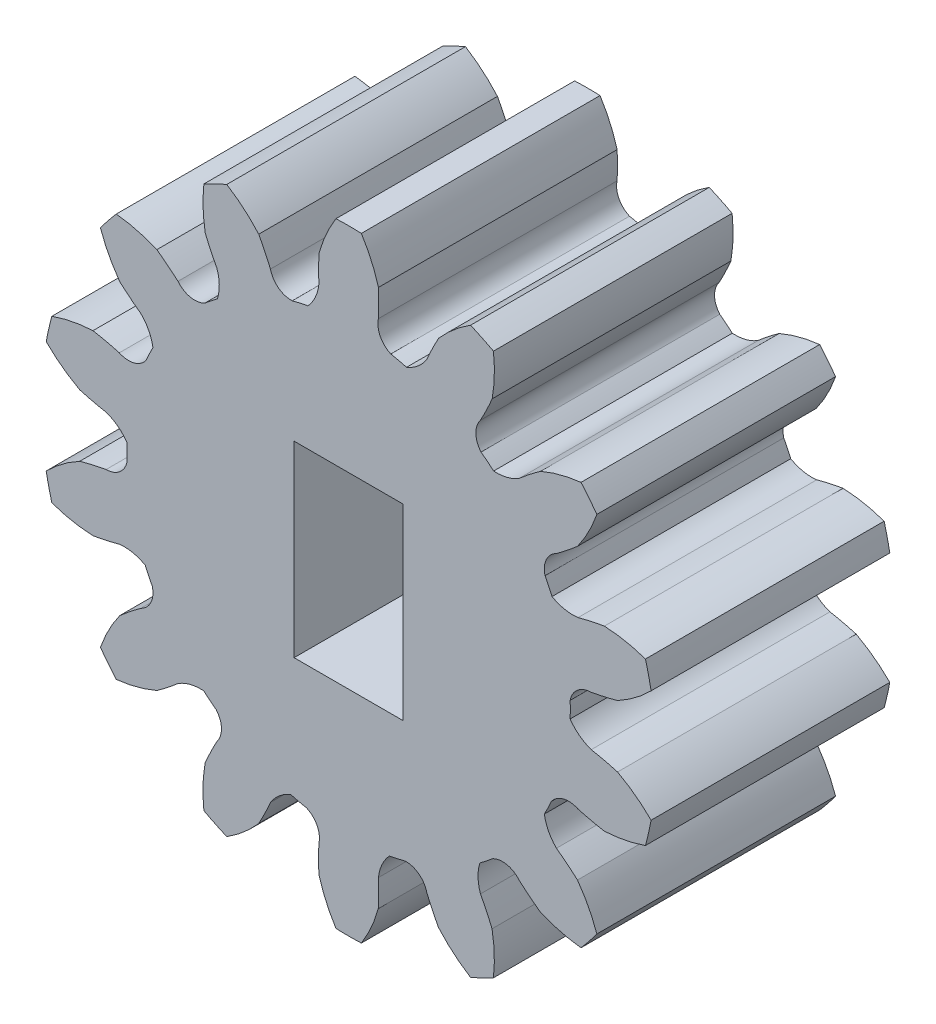
from build123d import *

# Parameters (mm, degrees)
BOSS_EXTRUDE1_DEPTH    = 7
BOSS_EXTRUDE1_2_DEPTH  = 7
BOSS_EXTRUDE1_3_DEPTH  = 7
BOSS_EXTRUDE1_4_DEPTH  = 7
BOSS_EXTRUDE1_5_DEPTH  = 7
BOSS_EXTRUDE1_6_DEPTH  = 7
BOSS_EXTRUDE1_7_DEPTH  = 7
BOSS_EXTRUDE1_8_DEPTH  = 7
BOSS_EXTRUDE1_9_DEPTH  = 7
BOSS_EXTRUDE1_10_DEPTH = 7
BOSS_EXTRUDE1_11_DEPTH = 7
BOSS_EXTRUDE1_12_DEPTH = 7
BOSS_EXTRUDE1_13_DEPTH = 7
BOSS_EXTRUDE1_14_DEPTH = 7
SKETCH1_R              = 6.5
BOSS_EXTRUDE2_DEPTH    = 7
SKETCH3_W              = 3.2
SKETCH3_H              = 5.5
CUT_EXTRUDE1_DEPTH     = 6


with BuildPart() as part:
    # Sketch2 → Boss-Extrude1 (new body)
    with BuildSketch(Plane.XY.offset(20)):
        with BuildLine():
            ThreePointArc((-0.372442837, 29.93778576), (0, 29.945381287), (0.372442837, 29.93778576))
            ThreePointArc((0.372442837, 29.93778576), (0.664207711, 29.394961978), (0.87300932, 28.815146242))
            ThreePointArc((0.87300932, 28.815146242), (0.882118298, 28.419135302), (0.87300932, 28.023124361))
            ThreePointArc((0.87300932, 28.023124361), (0.925832605, 27.599473266), (1.236429032, 27.306556197))
            ThreePointArc((1.236429032, 27.306556197), (0.022155909, 27.42519857), (-1.192897802, 27.314836852))
            ThreePointArc((-1.192897802, 27.314836852), (-0.97608072, 27.643294757), (-0.87300932, 28.023124361))
            ThreePointArc((-0.87300932, 28.023124361), (-0.8804421, 28.419198634), (-0.867969423, 28.815146242))
            ThreePointArc((-0.867969423, 28.815146242), (-0.661618034, 29.394744976), (-0.372442837, 29.93778576))
        make_face()
    extrude(amount=BOSS_EXTRUDE1_DEPTH)



with BuildPart() as body_2:
    # Sketch2 → Boss-Extrude1 2 (new body)
    with BuildSketch(Plane.XY.offset(20)):
        with BuildLine():
            ThreePointArc((1.697579984, 27.199646438), (2.840189705, 26.771886862), (3.882734989, 26.138140415))
            ThreePointArc((3.882734989, 26.138140415), (3.729989232, 26.536812314), (3.866212417, 26.941427926))
            ThreePointArc((3.866212417, 26.941427926), (4.04624203, 27.294269217), (4.209857833, 27.655014984))
            ThreePointArc((4.209857833, 27.655014984), (4.273306703, 28.268006533), (4.245958047, 28.883665896))
            ThreePointArc((4.245958047, 28.883665896), (3.913694222, 29.052106121), (3.574839244, 29.206859677))
            ThreePointArc((3.574839244, 29.206859677), (3.078684828, 28.843065253), (2.641290186, 28.41039735))
            ThreePointArc((2.641290186, 28.41039735), (2.458257463, 28.059072574), (2.29310398, 27.698997022))
            ThreePointArc((2.29310398, 27.698997022), (2.035437968, 27.401503378), (1.697579984, 27.199646438))
        make_face()
    extrude(amount=BOSS_EXTRUDE1_2_DEPTH)


with BuildPart() as body_3:
    # Sketch2 → Boss-Extrude1 3 (new body)
    with BuildSketch(Plane.XY.offset(20)):
        with BuildLine():
            ThreePointArc((4.251831235, 25.84173215), (5.095689097, 24.960574312), (5.760017664, 23.937245047))
            ThreePointArc((5.760017664, 23.937245047), (5.795375746, 24.362709917), (6.093664729, 24.668150961))
            ThreePointArc((6.093664729, 24.668150961), (6.408957905, 24.907938059), (6.712892371, 25.161968527))
            ThreePointArc((6.712892371, 25.161968527), (7.036024894, 25.686725397), (7.278509192, 26.253281452))
            ThreePointArc((7.278509192, 26.253281452), (7.052233304, 26.549204722), (6.81408057, 26.835656524))
            ThreePointArc((6.81408057, 26.835656524), (6.209216403, 26.723162406), (5.62740988, 26.523120518))
            ThreePointArc((5.62740988, 26.523120518), (5.310068987, 26.286002754), (5.005039914, 26.033243303))
            ThreePointArc((5.005039914, 26.033243303), (4.643813204, 25.877007884), (4.251831235, 25.84173215))
        make_face()
    extrude(amount=BOSS_EXTRUDE1_3_DEPTH)


with BuildPart() as body_4:
    # Sketch2 → Boss-Extrude1 4 (new body)
    with BuildSketch(Plane.XY.offset(20)):
        with BuildLine():
            ThreePointArc((5.963955164, 23.510045569), (6.341924769, 22.350013584), (6.496458198, 21.139784413))
            ThreePointArc((6.496458198, 21.139784413), (6.712917018, 21.507773718), (7.114192008, 21.65354385))
            ThreePointArc((7.114192008, 21.65354385), (7.502301066, 21.732783978), (7.886356247, 21.829785299))
            ThreePointArc((7.886356247, 21.829785299), (8.405172063, 22.162372954), (8.869462327, 22.567612329))
            ThreePointArc((8.869462327, 22.567612329), (8.793991091, 22.93240741), (8.703709671, 23.293822164))
            ThreePointArc((8.703709671, 23.293822164), (8.109936518, 23.454909193), (7.498952032, 23.52711407))
            ThreePointArc((7.498952032, 23.52711407), (7.110156225, 23.451167399), (6.725666309, 23.355786157))
            ThreePointArc((6.725666309, 23.355786157), (6.332424282, 23.371753304), (5.963955164, 23.510045569))
        make_face()
    extrude(amount=BOSS_EXTRUDE1_4_DEPTH)


with BuildPart() as body_5:
    # Sketch2 → Boss-Extrude1 5 (new body)
    with BuildSketch(Plane.XY.offset(20)):
        with BuildLine():
            ThreePointArc((6.49484463, 20.666405817), (6.332064462, 19.457258248), (5.946195512, 18.299829899))
            ThreePointArc((5.946195512, 18.299829899), (6.300882746, 18.537458845), (6.725666309, 18.494686503))
            ThreePointArc((6.725666309, 18.494686503), (7.109721491, 18.397685182), (7.497830549, 18.318445054))
            ThreePointArc((7.497830549, 18.318445054), (8.109571823, 18.392990431), (8.703709671, 18.556650496))
            ThreePointArc((8.703709671, 18.556650496), (8.793991091, 18.91806525), (8.869462327, 19.282860332))
            ThreePointArc((8.869462327, 19.282860332), (8.404384244, 19.685623245), (7.885234765, 20.015773825))
            ThreePointArc((7.885234765, 20.015773825), (7.501989821, 20.116040417), (7.114192008, 20.19692881))
            ThreePointArc((7.114192008, 20.19692881), (6.766821069, 20.381936033), (6.49484463, 20.666405817))
        make_face()
    extrude(amount=BOSS_EXTRUDE1_5_DEPTH)


with BuildPart() as body_6:
    # Sketch2 → Boss-Extrude1 6 (new body)
    with BuildSketch(Plane.XY.offset(20)):
        with BuildLine():
            ThreePointArc((5.739350463, 17.874030623), (5.06806113, 16.855253974), (4.21821588, 15.979869328))
            ThreePointArc((4.21821588, 15.979869328), (4.640881371, 16.040072587), (5.005039914, 15.817229357))
            ThreePointArc((5.005039914, 15.817229357), (5.30897438, 15.563198889), (5.624267555, 15.323411791))
            ThreePointArc((5.624267555, 15.323411791), (6.207771425, 15.125150264), (6.81408057, 15.014816136))
            ThreePointArc((6.81408057, 15.014816136), (7.052233304, 15.301267938), (7.278509192, 15.597191208))
            ThreePointArc((7.278509192, 15.597191208), (7.034240598, 16.161857871), (6.709750047, 16.684563783))
            ThreePointArc((6.709750047, 16.684563783), (6.407962328, 16.94118461), (6.093664729, 17.182321699))
            ThreePointArc((6.093664729, 17.182321699), (5.860965954, 17.499726049), (5.739350463, 17.874030623))
        make_face()
    extrude(amount=BOSS_EXTRUDE1_6_DEPTH)


with BuildPart() as body_7:
    # Sketch2 → Boss-Extrude1 7 (new body)
    with BuildSketch(Plane.XY.offset(20)):
        with BuildLine():
            ThreePointArc((3.847107548, 15.68598414), (2.800266136, 15.059359621), (1.65476686, 14.639399342))
            ThreePointArc((1.65476686, 14.639399342), (2.061696523, 14.510252921), (2.29310398, 14.151475639))
            ThreePointArc((2.29310398, 14.151475639), (2.456719782, 13.790729872), (2.636749396, 13.43788858))
            ThreePointArc((2.636749396, 13.43788858), (3.076445764, 13.006088276), (3.574839244, 12.643612983))
            ThreePointArc((3.574839244, 12.643612983), (3.913694222, 12.798366539), (4.245958047, 12.966806765))
            ThreePointArc((4.245958047, 12.966806765), (4.270879331, 13.58153802), (4.205317042, 14.193270947))
            ThreePointArc((4.205317042, 14.193270947), (4.044759307, 14.555419107), (3.866212417, 14.909044735))
            ThreePointArc((3.866212417, 14.909044735), (3.794274651, 15.295980387), (3.847107548, 15.68598414))
        make_face()
    extrude(amount=BOSS_EXTRUDE1_7_DEPTH)


with BuildPart() as body_8:
    # Sketch2 → Boss-Extrude1 8 (new body)
    with BuildSketch(Plane.XY.offset(20)):
        with BuildLine():
            ThreePointArc((1.192897802, 14.535635808), (-0.022155909, 14.425274091), (-1.236429032, 14.543916463))
            ThreePointArc((-1.236429032, 14.543916463), (-0.925832605, 14.250999394), (-0.87300932, 13.827348299))
            ThreePointArc((-0.87300932, 13.827348299), (-0.882118298, 13.431337359), (-0.87300932, 13.035326418))
            ThreePointArc((-0.87300932, 13.035326418), (-0.664207711, 12.455510682), (-0.372442837, 11.912686901))
            ThreePointArc((-0.372442837, 11.912686901), (0, 11.905091373), (0.372442837, 11.912686901))
            ThreePointArc((0.372442837, 11.912686901), (0.661618034, 12.455727684), (0.867969423, 13.035326418))
            ThreePointArc((0.867969423, 13.035326418), (0.8804421, 13.431274026), (0.87300932, 13.827348299))
            ThreePointArc((0.87300932, 13.827348299), (0.97608072, 14.207177903), (1.192897802, 14.535635808))
        make_face()
    extrude(amount=BOSS_EXTRUDE1_8_DEPTH)


with BuildPart() as body_9:
    # Sketch2 → Boss-Extrude1 9 (new body)
    with BuildSketch(Plane.XY.offset(20)):
        with BuildLine():
            ThreePointArc((-1.697579984, 14.650826223), (-2.840189705, 15.078585798), (-3.882734989, 15.712332245))
            ThreePointArc((-3.882734989, 15.712332245), (-3.729989232, 15.313660346), (-3.866212417, 14.909044735))
            ThreePointArc((-3.866212417, 14.909044735), (-4.04624203, 14.556203443), (-4.209857833, 14.195457676))
            ThreePointArc((-4.209857833, 14.195457676), (-4.273306703, 13.582466127), (-4.245958047, 12.966806765))
            ThreePointArc((-4.245958047, 12.966806765), (-3.913694222, 12.798366539), (-3.574839244, 12.643612983))
            ThreePointArc((-3.574839244, 12.643612983), (-3.078684828, 13.007407407), (-2.641290186, 13.44007531))
            ThreePointArc((-2.641290186, 13.44007531), (-2.458257463, 13.791400086), (-2.29310398, 14.151475639))
            ThreePointArc((-2.29310398, 14.151475639), (-2.035437968, 14.448969282), (-1.697579984, 14.650826223))
        make_face()
    extrude(amount=BOSS_EXTRUDE1_9_DEPTH)


with BuildPart() as body_10:
    # Sketch2 → Boss-Extrude1 10 (new body)
    with BuildSketch(Plane.XY.offset(20)):
        with BuildLine():
            ThreePointArc((-4.251831235, 16.00874051), (-5.095689097, 16.889898348), (-5.760017664, 17.913227613))
            ThreePointArc((-5.760017664, 17.913227613), (-5.795375746, 17.487762743), (-6.093664729, 17.182321699))
            ThreePointArc((-6.093664729, 17.182321699), (-6.408957905, 16.942534602), (-6.712892371, 16.688504133))
            ThreePointArc((-6.712892371, 16.688504133), (-7.036024894, 16.163747263), (-7.278509192, 15.597191208))
            ThreePointArc((-7.278509192, 15.597191208), (-7.052233304, 15.301267938), (-6.81408057, 15.014816136))
            ThreePointArc((-6.81408057, 15.014816136), (-6.209216403, 15.127310254), (-5.62740988, 15.327352142))
            ThreePointArc((-5.62740988, 15.327352142), (-5.310068987, 15.564469906), (-5.005039914, 15.817229357))
            ThreePointArc((-5.005039914, 15.817229357), (-4.643813204, 15.973464776), (-4.251831235, 16.00874051))
        make_face()
    extrude(amount=BOSS_EXTRUDE1_10_DEPTH)


with BuildPart() as body_11:
    # Sketch2 → Boss-Extrude1 11 (new body)
    with BuildSketch(Plane.XY.offset(20)):
        with BuildLine():
            ThreePointArc((-5.963955164, 18.340427091), (-6.341924769, 19.500459076), (-6.496458198, 20.710688248))
            ThreePointArc((-6.496458198, 20.710688248), (-6.712917018, 20.342698943), (-7.114192008, 20.19692881))
            ThreePointArc((-7.114192008, 20.19692881), (-7.502301066, 20.117688682), (-7.886356247, 20.020687361))
            ThreePointArc((-7.886356247, 20.020687361), (-8.405172063, 19.688099706), (-8.869462327, 19.282860332))
            ThreePointArc((-8.869462327, 19.282860332), (-8.793991091, 18.91806525), (-8.703709671, 18.556650496))
            ThreePointArc((-8.703709671, 18.556650496), (-8.109936518, 18.395563467), (-7.498952032, 18.323358591))
            ThreePointArc((-7.498952032, 18.323358591), (-7.110156225, 18.399305261), (-6.725666309, 18.494686503))
            ThreePointArc((-6.725666309, 18.494686503), (-6.332424282, 18.478719356), (-5.963955164, 18.340427091))
        make_face()
    extrude(amount=BOSS_EXTRUDE1_11_DEPTH)


with BuildPart() as body_12:
    # Sketch2 → Boss-Extrude1 12 (new body)
    with BuildSketch(Plane.XY.offset(20)):
        with BuildLine():
            ThreePointArc((-6.49484463, 21.184066843), (-6.332064462, 22.393214413), (-5.946195512, 23.550642761))
            ThreePointArc((-5.946195512, 23.550642761), (-6.300882746, 23.313013816), (-6.725666309, 23.355786157))
            ThreePointArc((-6.725666309, 23.355786157), (-7.109721491, 23.452787479), (-7.497830549, 23.532027606))
            ThreePointArc((-7.497830549, 23.532027606), (-8.109571823, 23.457482229), (-8.703709671, 23.293822164))
            ThreePointArc((-8.703709671, 23.293822164), (-8.793991091, 22.93240741), (-8.869462327, 22.567612329))
            ThreePointArc((-8.869462327, 22.567612329), (-8.404384244, 22.164849415), (-7.885234765, 21.834698836))
            ThreePointArc((-7.885234765, 21.834698836), (-7.501989821, 21.734432243), (-7.114192008, 21.65354385))
            ThreePointArc((-7.114192008, 21.65354385), (-6.766821069, 21.468536627), (-6.49484463, 21.184066843))
        make_face()
    extrude(amount=BOSS_EXTRUDE1_12_DEPTH)


with BuildPart() as body_13:
    # Sketch2 → Boss-Extrude1 13 (new body)
    with BuildSketch(Plane.XY.offset(20)):
        with BuildLine():
            ThreePointArc((-5.739350463, 23.976442037), (-5.06806113, 24.995218686), (-4.21821588, 25.870603333))
            ThreePointArc((-4.21821588, 25.870603333), (-4.640881371, 25.810400073), (-5.005039914, 26.033243303))
            ThreePointArc((-5.005039914, 26.033243303), (-5.30897438, 26.287273771), (-5.624267555, 26.527060869))
            ThreePointArc((-5.624267555, 26.527060869), (-6.207771425, 26.725322396), (-6.81408057, 26.835656524))
            ThreePointArc((-6.81408057, 26.835656524), (-7.052233304, 26.549204722), (-7.278509192, 26.253281452))
            ThreePointArc((-7.278509192, 26.253281452), (-7.034240598, 25.688614789), (-6.709750047, 25.165908878))
            ThreePointArc((-6.709750047, 25.165908878), (-6.407962328, 24.90928805), (-6.093664729, 24.668150961))
            ThreePointArc((-6.093664729, 24.668150961), (-5.860965954, 24.350746611), (-5.739350463, 23.976442037))
        make_face()
    extrude(amount=BOSS_EXTRUDE1_13_DEPTH)


with BuildPart() as body_14:
    # Sketch2 → Boss-Extrude1 14 (new body)
    with BuildSketch(Plane.XY.offset(20)):
        with BuildLine():
            ThreePointArc((-3.847107548, 26.16448852), (-2.800266136, 26.791113039), (-1.65476686, 27.211073318))
            ThreePointArc((-1.65476686, 27.211073318), (-2.061696523, 27.340219739), (-2.29310398, 27.698997022))
            ThreePointArc((-2.29310398, 27.698997022), (-2.456719782, 28.059742788), (-2.636749396, 28.41258408))
            ThreePointArc((-2.636749396, 28.41258408), (-3.076445764, 28.844384384), (-3.574839244, 29.206859677))
            ThreePointArc((-3.574839244, 29.206859677), (-3.913694222, 29.052106121), (-4.245958047, 28.883665896))
            ThreePointArc((-4.245958047, 28.883665896), (-4.270879331, 28.26893464), (-4.205317042, 27.657201713))
            ThreePointArc((-4.205317042, 27.657201713), (-4.044759307, 27.295053553), (-3.866212417, 26.941427926))
            ThreePointArc((-3.866212417, 26.941427926), (-3.794274651, 26.554492273), (-3.847107548, 26.16448852))
        make_face()
    extrude(amount=BOSS_EXTRUDE1_14_DEPTH)


with BuildPart() as part_1:
    add(part.part)

    add(body_2.part)  # Boss-Extrude2 merges body 2

    add(body_3.part)  # Boss-Extrude2 merges body 3

    add(body_4.part)  # Boss-Extrude2 merges body 4

    add(body_5.part)  # Boss-Extrude2 merges body 5

    add(body_6.part)  # Boss-Extrude2 merges body 6

    add(body_7.part)  # Boss-Extrude2 merges body 7

    add(body_8.part)  # Boss-Extrude2 merges body 8

    add(body_9.part)  # Boss-Extrude2 merges body 9

    add(body_10.part)  # Boss-Extrude2 merges body 10

    add(body_11.part)  # Boss-Extrude2 merges body 11

    add(body_12.part)  # Boss-Extrude2 merges body 12

    add(body_13.part)  # Boss-Extrude2 merges body 13

    add(body_14.part)  # Boss-Extrude2 merges body 14
    # Sketch1 → Boss-Extrude2 (add)
    with BuildSketch(Plane.XY.offset(20)):
        with Locations((0, 20.92523633)):
            Circle(SKETCH1_R)
    extrude(amount=BOSS_EXTRUDE2_DEPTH)

    # Sketch3 → Cut-Extrude1 (cut)
    with BuildSketch(Plane.XY.offset(27)):
        with Locations((0, 20.92523633)):
            Rectangle(SKETCH3_W, SKETCH3_H)
    extrude(amount=-CUT_EXTRUDE1_DEPTH, mode=Mode.SUBTRACT)


solid = part_1.part
